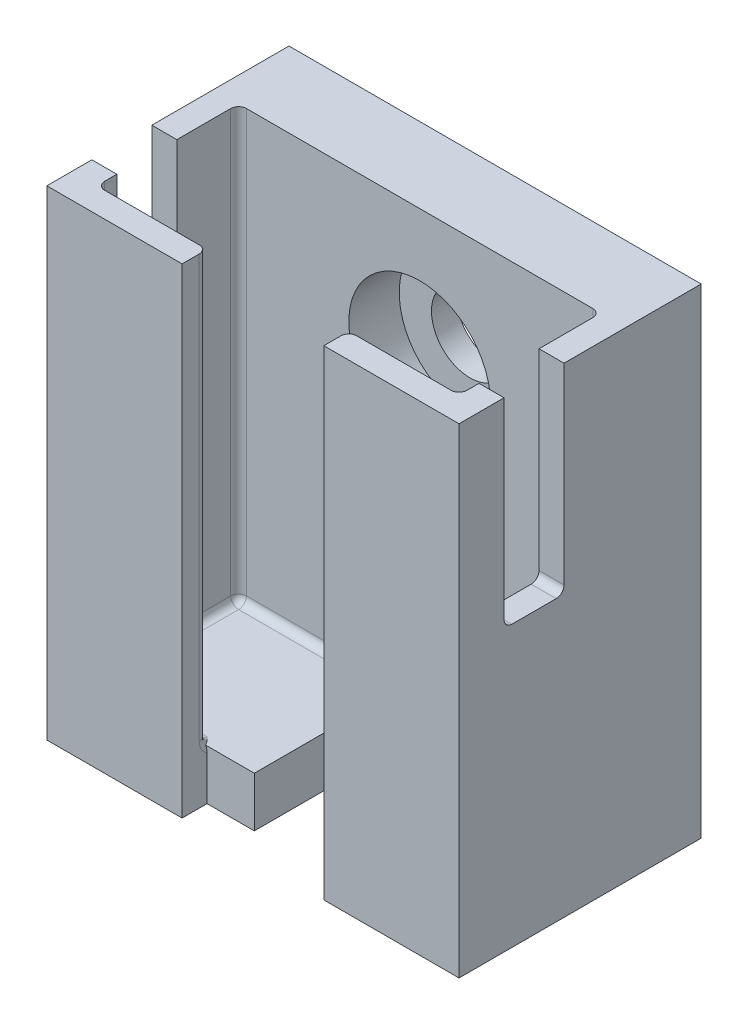
from build123d import *

# Parameters (mm, degrees)
BOSS_EXTRUDE1_DEPTH = 30.48
BOSS_EXTRUDE2_DEPTH = 3.175
SKETCH3_W           = 3.436
SKETCH3_H           = 3.81
CUT_EXTRUDE1_DEPTH  = 12.7
SKETCH5_R           = 2.45
CUT_EXTRUDE2_DEPTH  = 1.5875
SKETCH6_W           = 23
SKETCH6_H           = 27.305
SKETCH6_R           = 4.5
BOSS_EXTRUDE3_DEPTH = 3.2
FILLET3_R           = 0.5
FILLET1_R           = 0.5
FILLET5_R           = 0.5
FILLET4_R           = 0.5
FILLET6_R           = 0.5


with BuildPart() as part:
    # Sketch1 → Boss-Extrude1 (new body)
    with BuildSketch(Plane(origin=(0, 0, 0), x_dir=(1, 0, 0), z_dir=(0, 1, 0))):
        Polygon((4.5, -6.1), (4.5, -7.6875), (13.088, -7.6875), (13.088, 7.6875), (-13.088, 7.6875), (-13.088, -7.6875), (-4.5, -7.6875), (-4.5, -6.1), (-11.5, -6.1), (-11.5, 6.1), (11.5, 6.1), (11.5, -6.1), align=None)
    extrude(amount=BOSS_EXTRUDE1_DEPTH)

    # Sketch2 → Boss-Extrude2 (add)
    with BuildSketch(Plane.XZ):
        Polygon((11.5, 0), (11.5, 6.1), (9.5, 6.1), (9.5, 0), (-1.5, 0), (-1.5, 6.1), (-11.5, 6.1), (-11.5, -6.1), (11.5, -6.1), align=None)
    extrude(amount=-BOSS_EXTRUDE2_DEPTH)

    # Sketch3 → Cut-Extrude1 (cut)
    with BuildSketch(Plane(origin=(0, 30.48, 0), x_dir=(1, 0, 0), z_dir=(0, 1, 0))):
        with Locations((-11.37, -2.925)):
            Rectangle(SKETCH3_W, SKETCH3_H)
    cut_extrude1 = extrude(amount=-CUT_EXTRUDE1_DEPTH, mode=Mode.SUBTRACT)

    # Mirror1: Cut-Extrude1 across plane
    add(cut_extrude1.mirror(Plane(origin=(0, 0, 0), x_dir=(0, 0, 1), z_dir=(1, 0, 0))), mode=Mode.SUBTRACT)

    # Sketch5 → Cut-Extrude2 (cut)
    with BuildSketch(Plane(origin=(0, 0, -7.6875), x_dir=(-1, 0, 0), z_dir=(0, 0, -1))):
        with Locations((0, 8.466666667)):
            Circle(SKETCH5_R)
        with Locations((0, 22.013333333)):
            Circle(SKETCH5_R)
    extrude(amount=-CUT_EXTRUDE2_DEPTH, mode=Mode.SUBTRACT)

    # Sketch6 → Boss-Extrude3 (add)
    with BuildSketch(Plane.XY.offset(-6.1)):
        with Locations((0, 16.8275)):
            Rectangle(SKETCH6_W, SKETCH6_H)
        with Locations((0, 22.013333333)):
            Circle(SKETCH6_R, mode=Mode.SUBTRACT)
        with Locations((0, 8.466666667)):
            Circle(SKETCH6_R, mode=Mode.SUBTRACT)
    extrude(amount=BOSS_EXTRUDE3_DEPTH)

    # Fillet3
    fillet3_edges = [part.edges().sort_by_distance(p)[0] for p in [
        (11.5, 3.175, 1.6),
        (0, 3.175, -2.9),
        (11.5, 16.8275, -2.9),
        (11.5, 16.8275, 6.1),
    ]]
    fillet(fillet3_edges, radius=FILLET3_R)

    # Fillet1
    fillet1_edges = [part.edges().sort_by_distance(p)[0] for p in [
        (-11.5, 17.0775, -2.9),
        (-11.5, 3.321446609, -2.753553391),
        (4.5, 15.24, 6.1),
        (-11.5, 3.175, 1.85),
        (-8, 3.175, 6.1),
    ]]
    fillet(fillet1_edges, radius=FILLET1_R)

    # Fillet5
    # the kernel refuses this fillet: 0.5 mm, written as the material it adds along each edge
    with BuildSketch(Plane(origin=(-13.088, 17.78, 4.83), x_dir=(0, 1, 0), z_dir=(1, 0, 0)), Plane(origin=(11.5, 17.78, 1.02), x_dir=(0, 0, 1), z_dir=(1, 0, 0))) as fillet5_piece_1:
        with BuildLine():
            CenterArc((FILLET5_R, -FILLET5_R), FILLET5_R, 90, 90)
            Line((0, -FILLET5_R), (0, 0))
            Line((0, 0), (FILLET5_R, 0))
        make_face()
    extrude(amount=1.588)
    with BuildSketch(Plane(origin=(-11.5, 17.78, 1.02), x_dir=(0, 0, 1), z_dir=(-1, 0, 0)), Plane(origin=(13.088, 17.78, 4.83), x_dir=(0, 1, 0), z_dir=(-1, 0, 0))) as fillet5_piece_2:
        with BuildLine():
            CenterArc((FILLET5_R, FILLET5_R), FILLET5_R, 180, 90)
            Line((0, FILLET5_R), (0, 0))
            Line((0, 0), (FILLET5_R, 0))
        make_face()
    extrude(amount=1.588)
    # the kernel refuses this fillet: 0.5 mm, written as the material it takes off along each edge
    with BuildSketch(Plane(origin=(-4.5, 3.675, 6.1), x_dir=(0, 0, 1), z_dir=(0, 1, 0))) as fillet5_2_piece_1:
        with BuildLine():
            CenterArc((FILLET5_R, -FILLET5_R), FILLET5_R, 90, 90)
            Line((0, -FILLET5_R), (0, 0))
            Line((0, 0), (FILLET5_R, 0))
        make_face()
    extrude(amount=28.055, mode=Mode.SUBTRACT)
    with BuildSketch(Plane(origin=(-4.5, 3.675, 5.6), x_dir=(0, 0.8017442392976493, -0.5976672776328263), z_dir=(0, 0.5976672776328263, 0.8017442392976493))) as fillet5_2_piece_2_section:
        with BuildLine():
            CenterArc((0.5 + FILLET5_R, FILLET5_R), FILLET5_R, 180, 90)
            Line((0.5, FILLET5_R), (0.5, 0))
            Line((0.5, 0), (0.5 + FILLET5_R, 0))
        make_face()
    fillet5_2_piece_2 = revolve(axis=Axis((-4.5, 3.675, 5.6), (-1, 0, 0)), revolution_arc=233.296989237, mode=Mode.PRIVATE)
    fillet5_2_piece_2 = split(fillet5_2_piece_2, bisect_by=Plane(origin=(-4.655814155, 3.175, 5.974969475), z_dir=(0, 1, 0)), keep=Keep.TOP, mode=Mode.PRIVATE)
    add(fillet5_2_piece_2, mode=Mode.SUBTRACT)
    with BuildSketch(Plane(origin=(-4.5, 3.675, 5.6), x_dir=(0, 0.8017442392976493, -0.5976672776328263), z_dir=(0, 0.5976672776328263, 0.8017442392976493))) as fillet5_2_piece_3_section:
        with BuildLine():
            CenterArc((0.5 + FILLET5_R, FILLET5_R), FILLET5_R, 180, 90)
            Line((0.5, FILLET5_R), (0.5, 0))
            Line((0.5, 0), (0.5 + FILLET5_R, 0))
        make_face()
    fillet5_2_piece_3 = revolve(axis=Axis((-4.5, 3.675, 5.6), (-1, 0, 0)), revolution_arc=233.296989237, mode=Mode.PRIVATE)
    fillet5_2_piece_3 = split(fillet5_2_piece_3, bisect_by=Plane(origin=(-4.518548164, 3.09595455, 6.1), z_dir=(0, 0, 1)), keep=Keep.TOP, mode=Mode.PRIVATE)
    add(fillet5_2_piece_3, mode=Mode.SUBTRACT)

    # Fillet4
    # the kernel refuses this fillet: 0.5 mm, written as the material it adds along each edge
    with BuildSketch(Plane(origin=(-11, 3.675, 5.6), x_dir=(-1, 0, 0), z_dir=(0, 0, 1))) as fillet4_piece_1_section:
        Polygon((0, 0), (FILLET4_R, 0), (FILLET4_R, FILLET4_R), (0, FILLET4_R), align=None)
    fillet4_piece_1 = extrude(amount=FILLET4_R, mode=Mode.PRIVATE)
    fillet4_piece_1 = fillet4_piece_1 - Plane(origin=(-11, 3.675, 5.6), x_dir=(0.7071067811865475, 0.7071067811865475, 0), z_dir=(0, 0, 1)) * Sphere(FILLET4_R, mode=Mode.PRIVATE)
    add(fillet4_piece_1)
    with BuildSketch(Plane(origin=(-11.5, 3.675, 6.1), x_dir=(1, 0, 0), z_dir=(0, 1, 0))) as fillet4_piece_2:
        with BuildLine():
            CenterArc((FILLET4_R, FILLET4_R), FILLET4_R, 180, 90)
            Line((0, FILLET4_R), (0, 0))
            Line((0, 0), (FILLET4_R, 0))
        make_face()
    extrude(amount=26.805)

    # Fillet6
    # the kernel refuses this fillet: 0.5 mm, written as the material it adds along each edge
    with BuildSketch(Plane(origin=(11, 3.675, 5.6), x_dir=(0, 0, 1), z_dir=(0, -1, 0))) as fillet6_piece_1_section:
        Polygon((0, 0), (FILLET6_R, 0), (FILLET6_R, -FILLET6_R), (0, -FILLET6_R), align=None)
    fillet6_piece_1 = extrude(amount=FILLET6_R, mode=Mode.PRIVATE)
    fillet6_piece_1 = fillet6_piece_1 - Plane(origin=(11, 3.675, 5.6), x_dir=(-0.7071067811865475, 0, -0.7071067811865475), z_dir=(0, -1, 0)) * Sphere(FILLET6_R, mode=Mode.PRIVATE)
    add(fillet6_piece_1)
    with BuildSketch(Plane(origin=(11, 3.175, 6.1), x_dir=(0, 0, -1), z_dir=(-1, 0, 0))) as fillet6_piece_2:
        with BuildLine():
            CenterArc((FILLET6_R, -FILLET6_R), FILLET6_R, 90, 90)
            Line((0, -FILLET6_R), (0, 0))
            Line((0, 0), (FILLET6_R, 0))
        make_face()
    extrude(amount=1.5)
    with BuildSketch(Plane(origin=(-1.5, 0, 0), x_dir=(1, 0, 0), z_dir=(0, 1, 0)), Plane(origin=(9.5, 0, 0), x_dir=(0, 0, 1), z_dir=(0, 1, 0)), Plane(origin=(9.5, 0, 6.1), x_dir=(-1, 0, 0), z_dir=(0, 1, 0))) as fillet6_piece_3:
        with BuildLine():
            CenterArc((FILLET6_R, -FILLET6_R), FILLET6_R, 90, 90)
            Line((0, -FILLET6_R), (0, 0))
            Line((0, 0), (FILLET6_R, 0))
        make_face()
    extrude(amount=3.175)
    with BuildSketch(Plane(origin=(11, 3.175, 6.1), x_dir=(0, 0, -1), z_dir=(-1, 0, 0))) as fillet6_piece_4a_section:
        with BuildLine():
            CenterArc((FILLET6_R, -FILLET6_R), FILLET6_R, 90, 90)
            Line((0, -FILLET6_R), (0, 0))
            Line((0, 0), (FILLET6_R, 0))
        make_face()
    fillet6_piece_4a = extrude(amount=2.75, mode=Mode.PRIVATE)
    fillet6_piece_4a = split(fillet6_piece_4a, bisect_by=Plane(origin=(9.5, 3.288197557, 5.986802443), z_dir=(-1, 0, 0)), keep=Keep.TOP, mode=Mode.PRIVATE)
    with BuildSketch(Plane(origin=(9.5, 0, 6.1), x_dir=(-1, 0, 0), z_dir=(0, 1, 0))) as fillet6_piece_4b_section:
        with BuildLine():
            CenterArc((FILLET6_R, -FILLET6_R), FILLET6_R, 90, 90)
            Line((0, -FILLET6_R), (0, 0))
            Line((0, 0), (FILLET6_R, 0))
        make_face()
    fillet6_piece_4b = extrude(amount=4.425, mode=Mode.PRIVATE)
    fillet6_piece_4b = split(fillet6_piece_4b, bisect_by=Plane(origin=(9.386802443, 3.175, 5.986802443), z_dir=(0, 1, 0)), keep=Keep.TOP, mode=Mode.PRIVATE)
    fillet6_piece_4 = fillet6_piece_4a & fillet6_piece_4b
    add(fillet6_piece_4)


solid = part.part
